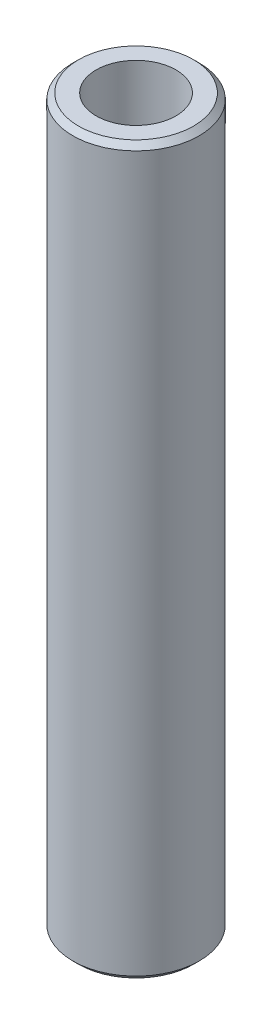
from build123d import *

# Parameters (mm, degrees)
SKETCH1_R           = 10
BOSS_EXTRUDE1_DEPTH = 114.949775311
SKETCH2_R           = 6.319482411
CUT_EXTRUDE1_DEPTH  = 116.816453253
CHAMFER1_SIZE       = 0.889017253


with BuildPart() as part:
    # Sketch1 → Boss-Extrude1 (new body)
    with BuildSketch(Plane(origin=(0, 0, 0), x_dir=(1, 0, 0), z_dir=(0, 1, 0))):
        Circle(SKETCH1_R)
    extrude(amount=BOSS_EXTRUDE1_DEPTH)

    # Sketch2 → Cut-Extrude1 (cut, through all)
    with BuildSketch(Plane(origin=(0, 0, 0), x_dir=(1, 0, 0), z_dir=(0, 1, 0))):
        Circle(SKETCH2_R)
    extrude(amount=CUT_EXTRUDE1_DEPTH, mode=Mode.SUBTRACT)

    # Chamfer1
    chamfer1_edges = [part.edges().sort_by_distance(p)[0] for p in [
        (-10, 114.949775311, 0),
        (-10, 0, 0),
    ]]
    chamfer(chamfer1_edges, length=CHAMFER1_SIZE)


solid = part.part
